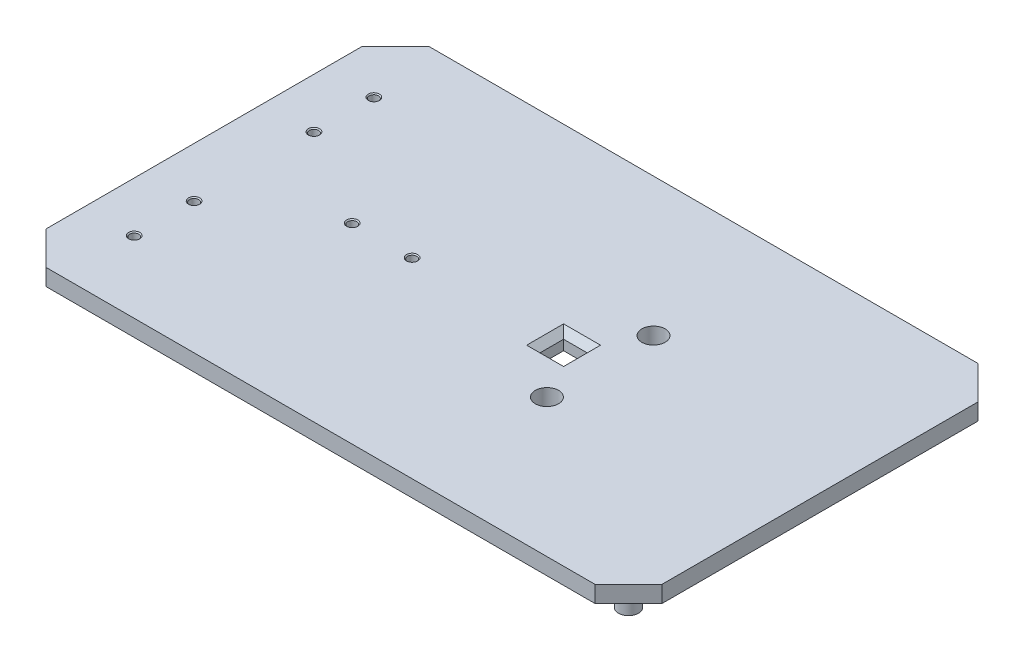
from build123d import *

# Parameters (mm, degrees)
SKETCH1_W               = 185
SKETCH1_H               = 115
BOSS_EXTRUDE2_DEPTH     = 5
CUT_EXTRUDE5_DEPTH      = 15
CUT_EXTRUDE5_DEPTH_BACK = 15
SKETCH1_7_OUTSIDE_W     = 230.578
SKETCH1_7_OUTSIDE_H     = 160.578
SKETCH1_7_OUTSIDE_W_2   = 185
SKETCH1_7_OUTSIDE_H_2   = 115
SKETCH1_7_OUTSIDE_R     = 1.375
CHAMFER2_SIZE           = 0.3
SKETCH10_R              = 3
BOSS_EXTRUDE3_DEPTH     = 6
SKETCH11_R              = 4
BOSS_EXTRUDE4_DEPTH     = 4
CUT_EXTRUDE6_DEPTH      = 10
CUT_EXTRUDE6_DEPTH_BACK = 3
SKETCH13_R              = 3.5
CUT_EXTRUDE8_DEPTH      = 7
CUT_EXTRUDE8_DEPTH_BACK = 7
SKETCH14_R              = 1.375
CHAMFER3_SIZE           = 1.625
CHAMFER6_SIZE           = 10
CUT_EXTRUDE9_DEPTH      = 10
CUT_EXTRUDE9_DEPTH_BACK = 10
SKETCH15_W              = 7.1
SKETCH15_H              = 7.1
CHAMFER7_SIZE           = 2


with BuildPart() as part:
    # Sketch1 → Boss-Extrude2 (new body)
    with BuildSketch(Plane(origin=(0, 0, 0), x_dir=(1, 0, 0), z_dir=(0, 1, 0))):
        Rectangle(SKETCH1_W, SKETCH1_H)
    extrude(amount=BOSS_EXTRUDE2_DEPTH)

    # Sketch1<7> outside → Cut-Extrude5 (cut, two sides: drawn at the far end of the back side and taken through both)
    # profile 1 of 9: a face of its own
    with BuildSketch(Plane(origin=(0, 0, 0), x_dir=(1, 0, 0), z_dir=(0, 1, 0)).offset(-CUT_EXTRUDE5_DEPTH_BACK)):
        Rectangle(SKETCH1_7_OUTSIDE_W, SKETCH1_7_OUTSIDE_H)
        Rectangle(SKETCH1_7_OUTSIDE_W_2, SKETCH1_7_OUTSIDE_H_2, mode=Mode.SUBTRACT)
    # profile 2 of 9: a face of its own
    with BuildSketch(Plane(origin=(0, 0, 0), x_dir=(1, 0, 0), z_dir=(0, 1, 0)).offset(-CUT_EXTRUDE5_DEPTH_BACK)):
        with Locations(Location((26.5, 16, 0), (0, 0, 270))):
            Circle(SKETCH1_7_OUTSIDE_R)
    # profile 3 of 9: a face of its own
    with BuildSketch(Plane(origin=(0, 0, 0), x_dir=(1, 0, 0), z_dir=(0, 1, 0)).offset(-CUT_EXTRUDE5_DEPTH_BACK)):
        with Locations(Location((26.5, -16, 0), (0, 0, 270))):
            Circle(SKETCH1_7_OUTSIDE_R)
    # profile 4 of 9: a face of its own
    with BuildSketch(Plane(origin=(0, 0, 0), x_dir=(1, 0, 0), z_dir=(0, 1, 0)).offset(-CUT_EXTRUDE5_DEPTH_BACK)):
        with Locations(Location((-77.5, 36, 0), (0, 0, 270))):
            Circle(SKETCH1_7_OUTSIDE_R)
    # profile 5 of 9: a face of its own
    with BuildSketch(Plane(origin=(0, 0, 0), x_dir=(1, 0, 0), z_dir=(0, 1, 0)).offset(-CUT_EXTRUDE5_DEPTH_BACK)):
        with Locations(Location((-77.5, 18, 0), (0, 0, 270))):
            Circle(SKETCH1_7_OUTSIDE_R)
    # profile 6 of 9: a face of its own
    with BuildSketch(Plane(origin=(0, 0, 0), x_dir=(1, 0, 0), z_dir=(0, 1, 0)).offset(-CUT_EXTRUDE5_DEPTH_BACK)):
        with Locations(Location((-77.5, -18, 0), (0, 0, 270))):
            Circle(SKETCH1_7_OUTSIDE_R)
    # profile 7 of 9: a face of its own
    with BuildSketch(Plane(origin=(0, 0, 0), x_dir=(1, 0, 0), z_dir=(0, 1, 0)).offset(-CUT_EXTRUDE5_DEPTH_BACK)):
        with Locations(Location((-77.5, -36, 0), (0, 0, 270))):
            Circle(SKETCH1_7_OUTSIDE_R)
    # profile 8 of 9: a face of its own
    with BuildSketch(Plane(origin=(0, 0, 0), x_dir=(1, 0, 0), z_dir=(0, 1, 0)).offset(-CUT_EXTRUDE5_DEPTH_BACK)):
        with Locations(Location((-48, 0, 0), (0, 0, 270))):
            Circle(SKETCH1_7_OUTSIDE_R)
    # profile 9 of 9: a face of its own
    with BuildSketch(Plane(origin=(0, 0, 0), x_dir=(1, 0, 0), z_dir=(0, 1, 0)).offset(-CUT_EXTRUDE5_DEPTH_BACK)):
        with Locations(Location((-30, 0, 0), (0, 0, 270))):
            Circle(SKETCH1_7_OUTSIDE_R)
    extrude(amount=CUT_EXTRUDE5_DEPTH + CUT_EXTRUDE5_DEPTH_BACK, mode=Mode.SUBTRACT)

    # Chamfer2
    chamfer2_edges = [part.edges().sort_by_distance(p)[0] for p in [
        (26.5, 5, -17.375),
        (26.5, 5, 14.625),
        (-77.5, 5, -37.375),
        (-77.5, 5, -19.375),
        (-77.5, 5, 16.625),
        (-77.5, 5, 34.625),
        (-48, 5, -1.375),
        (-30, 5, -1.375),
    ]]
    chamfer(chamfer2_edges, length=CHAMFER2_SIZE)

    # Sketch10 → Boss-Extrude3 (add)
    with BuildSketch(Plane(origin=(0, 0, 0), x_dir=(1, 0, 0), z_dir=(0, 1, 0))):
        with Locations(Location((82.5, -47.5, 0), (0, 0, 270))):
            Circle(SKETCH10_R)
        with Locations(Location((82.5, 47.5, 0), (0, 0, 270))):
            Circle(SKETCH10_R)
    extrude(amount=-BOSS_EXTRUDE3_DEPTH)

    # Sketch11 → Boss-Extrude4 (add)
    with BuildSketch(Plane(origin=(0, 0, 0), x_dir=(1, 0, 0), z_dir=(0, 1, 0))):
        with Locations(Location((26.5, -16, 0), (0, 0, 270))):
            Circle(SKETCH11_R)
        with Locations(Location((26.5, 16, 0), (0, 0, 270))):
            Circle(SKETCH11_R)
    extrude(amount=-BOSS_EXTRUDE4_DEPTH)

    # Sketch13 → Cut-Extrude6 (cut, two sides: drawn at the far end of the back side and taken through both)
    with BuildSketch(Plane(origin=(0, 0, 0), x_dir=(1, 0, 0), z_dir=(0, 1, 0)).offset(-CUT_EXTRUDE6_DEPTH_BACK)):
        with Locations(Location((26.5, 16, 0), (0, 0, 270))):
            Circle(SKETCH13_R)
        with Locations(Location((26.5, -16, 0), (0, 0, 270))):
            Circle(SKETCH13_R)
    extrude(amount=CUT_EXTRUDE6_DEPTH + CUT_EXTRUDE6_DEPTH_BACK, mode=Mode.SUBTRACT)

    # Sketch14 → Cut-Extrude8 (cut, two sides: drawn at the far end of the back side and taken through both)
    with BuildSketch(Plane(origin=(0, 0, 0), x_dir=(1, 0, 0), z_dir=(0, 1, 0)).offset(-CUT_EXTRUDE8_DEPTH_BACK)):
        with Locations(Location((26.5, 16, 0), (0, 0, 270))):
            Circle(SKETCH14_R)
        with Locations(Location((26.5, -16, 0), (0, 0, 270))):
            Circle(SKETCH14_R)
    extrude(amount=CUT_EXTRUDE8_DEPTH + CUT_EXTRUDE8_DEPTH_BACK, mode=Mode.SUBTRACT)

    # Chamfer3
    # the kernel refuses this chamfer: 1.625 mm, written as the material it takes off along each edge
    with BuildSketch(Plane(origin=(26.5, -3, 16), x_dir=(0, 0, 1), z_dir=(-1, 0, 0))) as chamfer3_piece_1:
        Polygon((1.375 + CHAMFER3_SIZE, 0), (1.375, -CHAMFER3_SIZE), (1.375, 0), align=None)
    revolve(axis=Axis((26.5, -3, 16), (0, 1, 0)), mode=Mode.SUBTRACT)
    with BuildSketch(Plane(origin=(26.5, -3, -16), x_dir=(0, 0, 1), z_dir=(-1, 0, 0))) as chamfer3_piece_2:
        Polygon((1.375 + CHAMFER3_SIZE, 0), (1.375, -CHAMFER3_SIZE), (1.375, 0), align=None)
    revolve(axis=Axis((26.5, -3, -16), (0, 1, 0)), mode=Mode.SUBTRACT)

    # Chamfer6
    chamfer6_edges = [part.edges().sort_by_distance(p)[0] for p in [
        (-92.5, 2.5, -57.5),
        (92.5, 2.5, -57.5),
        (92.5, 2.5, 57.5),
        (-92.5, 2.5, 57.5),
    ]]
    chamfer(chamfer6_edges, length=CHAMFER6_SIZE)

    # Sketch15 → Cut-Extrude9 (cut, two sides: drawn at the far end of the back side and taken through both)
    with BuildSketch(Plane(origin=(0, 5, 0), x_dir=(1, 0, 0), z_dir=(0, 1, 0)).offset(-CUT_EXTRUDE9_DEPTH_BACK)):
        with Locations((15.5, 0)):
            Rectangle(SKETCH15_W, SKETCH15_H)
    extrude(amount=CUT_EXTRUDE9_DEPTH + CUT_EXTRUDE9_DEPTH_BACK, mode=Mode.SUBTRACT)

    # Chamfer7
    chamfer7_edges = [part.edges().sort_by_distance(p)[0] for p in [
        (19.05, 5, 0),
        (15.5, 5, -3.55),
        (11.95, 5, 0),
        (15.5, 5, 3.55),
    ]]
    chamfer(chamfer7_edges, length=CHAMFER7_SIZE)


solid = part.part
